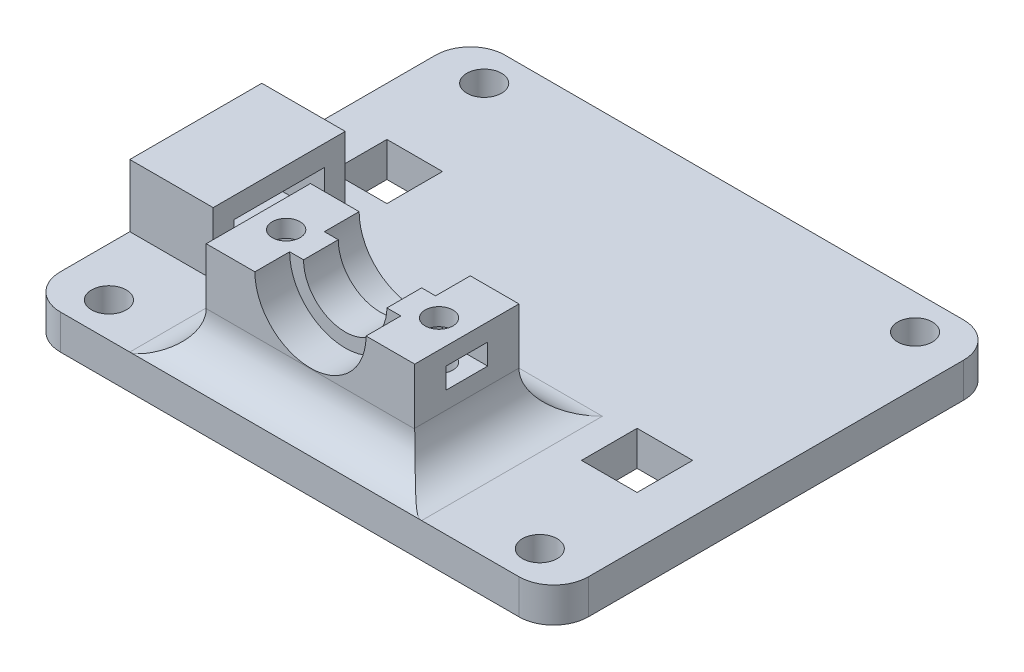
from build123d import *

# Parameters (mm, degrees)
SKETCH1_W           = 76
SKETCH1_H           = 64
SKETCH1_R           = 2.5
BOSS_EXTRUDE1_DEPTH = 5
SKETCH2_W           = 30
SKETCH2_H           = 15
BOSS_EXTRUDE2_DEPTH = 14
SKETCH3_R           = 6
CUT_EXTRUDE1_DEPTH  = 76.964442768
CUT_EXTRUDE2_DEPTH  = 5
CUT_EXTRUDE3_START  = -5
CUT_EXTRUDE3_DEPTH  = 5
FILLET1_R           = 6
SKETCH6_W           = 8
SKETCH6_H           = 8
CUT_EXTRUDE4_DEPTH  = 66.432910035
SKETCH7_W           = 12
SKETCH7_H           = 19
BOSS_EXTRUDE3_DEPTH = 9
SKETCH9_W           = 13
SKETCH9_H           = 6
CUT_EXTRUDE5_DEPTH  = 14
FILLET3_R           = 5
CUT_EXTRUDE6_DEPTH  = 9
SKETCH11_W          = 3
SKETCH11_H          = 1.5
CUT_EXTRUDE7_DEPTH  = 6.5
SKETCH13_W          = 3
SKETCH13_H          = 1.5
CUT_EXTRUDE8_DEPTH  = 6.5


with BuildPart() as part:
    # Sketch1 → Boss-Extrude1 (new body)
    with BuildSketch(Plane(origin=(0, 0, 0), x_dir=(1, 0, 0), z_dir=(0, 1, 0))):
        with Locations((5.915789474, -14.442105263)):
            Rectangle(SKETCH1_W, SKETCH1_H)
        with Locations(Location((36.915789474, 12.557894737, 0), (0, 0, 270))):
            Circle(SKETCH1_R, mode=Mode.SUBTRACT)
        with Locations(Location((-25.084210526, 12.557894737, 0), (0, 0, 270))):
            Circle(SKETCH1_R, mode=Mode.SUBTRACT)
        with Locations(Location((36.915789474, -41.442105263, 0), (0, 0, 270))):
            Circle(SKETCH1_R, mode=Mode.SUBTRACT)
        with Locations(Location((-25.084210526, -41.442105263, 0), (0, 0, 270))):
            Circle(SKETCH1_R, mode=Mode.SUBTRACT)
    extrude(amount=BOSS_EXTRUDE1_DEPTH)

    # Sketch2 → Boss-Extrude2 (add)
    with BuildSketch(Plane(origin=(0, 5, 0), x_dir=(1, 0, 0), z_dir=(0, 1, 0))):
        with Locations((3.915789474, -33.942105263)):
            Rectangle(SKETCH2_W, SKETCH2_H)
    extrude(amount=BOSS_EXTRUDE2_DEPTH)

    # Sketch3 → Cut-Extrude1 (cut, through all)
    with BuildSketch(Plane.XY.offset(41.442105263)):
        with Locations((3.915789474, 19)):
            Circle(SKETCH3_R)
    extrude(amount=-CUT_EXTRUDE1_DEPTH, mode=Mode.SUBTRACT)

    # Sketch4 → Cut-Extrude2 (cut)
    with BuildSketch(Plane.XY.offset(41.442105263)):
        with BuildLine():
            ThreePointArc((9.915789474, 19), (3.915789474, 13), (-2.084210526, 19))
            Line((-2.084210526, 19), (-4.084210526, 19))
            ThreePointArc((-4.084210526, 19), (3.915789474, 11), (11.915789474, 19))
            Line((11.915789474, 19), (9.915789474, 19))
        make_face()
    extrude(amount=-CUT_EXTRUDE2_DEPTH, mode=Mode.SUBTRACT)

    # Sketch5 → Cut-Extrude3 (cut)
    with BuildSketch(Plane(origin=(0, 0, 26.442105263), x_dir=(-1, 0, 0), z_dir=(0, 0, -1)).offset(CUT_EXTRUDE3_START)):
        with BuildLine():
            ThreePointArc((2.084210526, 19), (-3.915789474, 13), (-9.915789474, 19))
            Line((-9.915789474, 19), (-11.915789474, 19))
            ThreePointArc((-11.915789474, 19), (-3.915789474, 11), (4.084210526, 19))
            Line((4.084210526, 19), (2.084210526, 19))
        make_face()
    extrude(amount=CUT_EXTRUDE3_DEPTH, mode=Mode.SUBTRACT)

    # Fillet1
    # the kernel refuses this fillet: 6 mm, written as the material it adds along each edge
    with BuildSketch(Plane(origin=(-11.084210526, 5, 41.442105263), x_dir=(-1, 0, 0), z_dir=(0, 0, -1)), Plane(origin=(18.915789474, 5, 26.442105263), x_dir=(1, 0, 0), z_dir=(0, 0, 1))) as fillet1_piece_1:
        with BuildLine():
            CenterArc((FILLET1_R, FILLET1_R), FILLET1_R, 180, 90)
            Line((0, FILLET1_R), (-FILLET1_R * 0.02, FILLET1_R))
            Line((-FILLET1_R * 0.02, FILLET1_R), (-FILLET1_R * 0.02, -FILLET1_R * 0.02))
            Line((-FILLET1_R * 0.02, -FILLET1_R * 0.02), (FILLET1_R, -FILLET1_R * 0.02))
            Line((FILLET1_R, -FILLET1_R * 0.02), (FILLET1_R, 0))
        make_face()
    extrude(amount=15)
    with BuildSketch(Plane(origin=(18.915789474, 5, 41.442105263), x_dir=(0, 0, 1), z_dir=(-1, 0, 0))) as fillet1_piece_2:
        with BuildLine():
            CenterArc((6, 5.916079783), FILLET1_R, 180, 80.405931773)
            Line((0, 5.916079783), (-0.12, 5.916079783))
            Line((-0.12, 5.916079783), (-0.12, 0))
            Line((-0.12, 0), (0, -0.12))
            ThreePointArc((0, -0.12), (2.5, -0.12), (4.98, -0.118321596))
            Line((4.98, -0.118321596), (5, 0))
        make_face()
    extrude(amount=30)
    with BuildSketch(Plane(origin=(-11.084210526, 5, 26.442105263), x_dir=(0, 0, -1), z_dir=(1, 0, 0))) as fillet1_piece_3:
        with BuildLine():
            CenterArc((FILLET1_R, FILLET1_R), FILLET1_R, 180, 90)
            Line((0, FILLET1_R), (-FILLET1_R * 0.02, FILLET1_R))
            Line((-FILLET1_R * 0.02, FILLET1_R), (-FILLET1_R * 0.02, -FILLET1_R * 0.02))
            Line((-FILLET1_R * 0.02, -FILLET1_R * 0.02), (FILLET1_R, -FILLET1_R * 0.02))
            Line((FILLET1_R, -FILLET1_R * 0.02), (FILLET1_R, 0))
        make_face()
    extrude(amount=30)
    with BuildSketch(Plane(origin=(18.915789474, 5, 41.442105263), x_dir=(0, 0, 1), z_dir=(-1, 0, 0))) as fillet1_piece_4a_section:
        with BuildLine():
            CenterArc((6, 5.916079783), FILLET1_R, 180, 80.405931773)
            Line((0, 5.916079783), (-0.12, 5.916079783))
            Line((-0.12, 5.916079783), (-0.12, 0))
            Line((-0.12, 0), (0, -0.12))
            ThreePointArc((0, -0.12), (2.5, -0.12), (4.98, -0.118321596))
            Line((4.98, -0.118321596), (5, 0))
        make_face()
    fillet1_piece_4a = extrude(amount=44.790199458, mode=Mode.PRIVATE)
    fillet1_piece_4a = fillet1_piece_4a - Plane(origin=(-25.084210526, 6.312351874, 41.442105263), x_dir=(0, 0, 1), z_dir=(0, -1, 0)) * Cylinder(2.5, 114, mode=Mode.PRIVATE)
    fillet1_piece_4a = split(fillet1_piece_4a, bisect_by=Plane(origin=(-11.084210526, 6.312351874, 42.775348467), z_dir=(-1, 0, 0)), keep=Keep.TOP, mode=Mode.PRIVATE)
    with BuildSketch(Plane(origin=(-11.084210526, 5, 56.442105263), x_dir=(-1, 0, 0), z_dir=(0, 0, -1))) as fillet1_piece_4b_section:
        with BuildLine():
            CenterArc((FILLET1_R, FILLET1_R), FILLET1_R, 180, 90)
            Line((0, FILLET1_R), (-FILLET1_R * 0.02, FILLET1_R))
            Line((-FILLET1_R * 0.02, FILLET1_R), (-FILLET1_R * 0.02, -FILLET1_R * 0.02))
            Line((-FILLET1_R * 0.02, -FILLET1_R * 0.02), (FILLET1_R, -FILLET1_R * 0.02))
            Line((FILLET1_R, -FILLET1_R * 0.02), (FILLET1_R, 0))
        make_face()
    fillet1_piece_4b = extrude(amount=30, mode=Mode.PRIVATE)
    fillet1_piece_4b = split(fillet1_piece_4b, bisect_by=Plane(origin=(-12.442581212, 6.358370686, 46.442105263), z_dir=(0, 0, -1)), keep=Keep.TOP, mode=Mode.PRIVATE)
    fillet1_piece_4b = split(fillet1_piece_4b, bisect_by=Plane(origin=(-12.442581212, 6.358370686, 41.442105263), z_dir=(0, 0, 1)), keep=Keep.TOP, mode=Mode.PRIVATE)
    fillet1_piece_4 = fillet1_piece_4a & fillet1_piece_4b
    add(fillet1_piece_4)
    with BuildSketch(Plane(origin=(-26.084210526, 5, 26.442105263), x_dir=(0, 0, -1), z_dir=(1, 0, 0))) as fillet1_piece_5a_section:
        with BuildLine():
            CenterArc((FILLET1_R, FILLET1_R), FILLET1_R, 180, 90)
            Line((0, FILLET1_R), (-FILLET1_R * 0.02, FILLET1_R))
            Line((-FILLET1_R * 0.02, FILLET1_R), (-FILLET1_R * 0.02, -FILLET1_R * 0.02))
            Line((-FILLET1_R * 0.02, -FILLET1_R * 0.02), (FILLET1_R, -FILLET1_R * 0.02))
            Line((FILLET1_R, -FILLET1_R * 0.02), (FILLET1_R, 0))
        make_face()
    fillet1_piece_5a = extrude(amount=45, mode=Mode.PRIVATE)
    fillet1_piece_5a = split(fillet1_piece_5a, bisect_by=Plane(origin=(-11.084210526, 6.358370686, 25.083734578), z_dir=(-1, 0, 0)), keep=Keep.TOP, mode=Mode.PRIVATE)
    with BuildSketch(Plane(origin=(-11.084210526, 5, 41.442105263), x_dir=(-1, 0, 0), z_dir=(0, 0, -1))) as fillet1_piece_5b_section:
        with BuildLine():
            CenterArc((FILLET1_R, FILLET1_R), FILLET1_R, 180, 90)
            Line((0, FILLET1_R), (-FILLET1_R * 0.02, FILLET1_R))
            Line((-FILLET1_R * 0.02, FILLET1_R), (-FILLET1_R * 0.02, -FILLET1_R * 0.02))
            Line((-FILLET1_R * 0.02, -FILLET1_R * 0.02), (FILLET1_R, -FILLET1_R * 0.02))
            Line((FILLET1_R, -FILLET1_R * 0.02), (FILLET1_R, 0))
        make_face()
    fillet1_piece_5b = extrude(amount=30, mode=Mode.PRIVATE)
    fillet1_piece_5b = split(fillet1_piece_5b, bisect_by=Plane(origin=(-12.442581212, 6.358370686, 26.442105263), z_dir=(0, 0, -1)), keep=Keep.TOP, mode=Mode.PRIVATE)
    fillet1_piece_5 = fillet1_piece_5a & fillet1_piece_5b
    add(fillet1_piece_5)
    with BuildSketch(Plane(origin=(18.915789474, 5, 26.442105263), x_dir=(1, 0, 0), z_dir=(0, 0, 1))) as fillet1_piece_6a_section:
        with BuildLine():
            CenterArc((FILLET1_R, FILLET1_R), FILLET1_R, 180, 90)
            Line((0, FILLET1_R), (-FILLET1_R * 0.02, FILLET1_R))
            Line((-FILLET1_R * 0.02, FILLET1_R), (-FILLET1_R * 0.02, -FILLET1_R * 0.02))
            Line((-FILLET1_R * 0.02, -FILLET1_R * 0.02), (FILLET1_R, -FILLET1_R * 0.02))
            Line((FILLET1_R, -FILLET1_R * 0.02), (FILLET1_R, 0))
        make_face()
    fillet1_piece_6a = extrude(amount=30, mode=Mode.PRIVATE)
    fillet1_piece_6a = split(fillet1_piece_6a, bisect_by=Plane(origin=(20.274160159, 6.358370686, 46.442105263), z_dir=(0, 0, -1)), keep=Keep.TOP, mode=Mode.PRIVATE)
    fillet1_piece_6a = split(fillet1_piece_6a, bisect_by=Plane(origin=(20.274160159, 6.358370686, 41.442105263), z_dir=(0, 0, 1)), keep=Keep.TOP, mode=Mode.PRIVATE)
    with BuildSketch(Plane(origin=(33.705988931, 5, 41.442105263), x_dir=(0, 0, 1), z_dir=(-1, 0, 0))) as fillet1_piece_6b_section:
        with BuildLine():
            CenterArc((6, 5.916079783), FILLET1_R, 180, 80.405931773)
            Line((0, 5.916079783), (-0.12, 5.916079783))
            Line((-0.12, 5.916079783), (-0.12, 0))
            Line((-0.12, 0), (0, -0.12))
            ThreePointArc((0, -0.12), (2.5, -0.12), (4.98, -0.118321596))
            Line((4.98, -0.118321596), (5, 0))
        make_face()
    fillet1_piece_6b = extrude(amount=44.790199458, mode=Mode.PRIVATE)
    fillet1_piece_6b = split(fillet1_piece_6b, bisect_by=Plane(origin=(18.915789474, 6.37196406, 42.676023134), z_dir=(1, 0, 0)), keep=Keep.TOP, mode=Mode.PRIVATE)
    fillet1_piece_6 = fillet1_piece_6a & fillet1_piece_6b
    add(fillet1_piece_6)
    with BuildSketch(Plane(origin=(-11.084210526, 5, 26.442105263), x_dir=(0, 0, -1), z_dir=(1, 0, 0))) as fillet1_piece_7a_section:
        with BuildLine():
            CenterArc((FILLET1_R, FILLET1_R), FILLET1_R, 180, 90)
            Line((0, FILLET1_R), (-FILLET1_R * 0.02, FILLET1_R))
            Line((-FILLET1_R * 0.02, FILLET1_R), (-FILLET1_R * 0.02, -FILLET1_R * 0.02))
            Line((-FILLET1_R * 0.02, -FILLET1_R * 0.02), (FILLET1_R, -FILLET1_R * 0.02))
            Line((FILLET1_R, -FILLET1_R * 0.02), (FILLET1_R, 0))
        make_face()
    fillet1_piece_7a = extrude(amount=45, mode=Mode.PRIVATE)
    fillet1_piece_7a = split(fillet1_piece_7a, bisect_by=Plane(origin=(18.915789474, 6.358370686, 25.083734578), z_dir=(1, 0, 0)), keep=Keep.TOP, mode=Mode.PRIVATE)
    with BuildSketch(Plane(origin=(18.915789474, 5, 11.442105263), x_dir=(1, 0, 0), z_dir=(0, 0, 1))) as fillet1_piece_7b_section:
        with BuildLine():
            CenterArc((FILLET1_R, FILLET1_R), FILLET1_R, 180, 90)
            Line((0, FILLET1_R), (-FILLET1_R * 0.02, FILLET1_R))
            Line((-FILLET1_R * 0.02, FILLET1_R), (-FILLET1_R * 0.02, -FILLET1_R * 0.02))
            Line((-FILLET1_R * 0.02, -FILLET1_R * 0.02), (FILLET1_R, -FILLET1_R * 0.02))
            Line((FILLET1_R, -FILLET1_R * 0.02), (FILLET1_R, 0))
        make_face()
    fillet1_piece_7b = extrude(amount=30, mode=Mode.PRIVATE)
    fillet1_piece_7b = split(fillet1_piece_7b, bisect_by=Plane(origin=(20.274160159, 6.358370686, 26.442105263), z_dir=(0, 0, -1)), keep=Keep.TOP, mode=Mode.PRIVATE)
    fillet1_piece_7 = fillet1_piece_7a & fillet1_piece_7b
    add(fillet1_piece_7)

    # Sketch6 → Cut-Extrude4 (cut, through all)
    with BuildSketch(Plane(origin=(0, 5, 0), x_dir=(1, 0, 0), z_dir=(0, 1, 0))):
        with Locations((32.915789474, -23.442105263)):
            Rectangle(SKETCH6_W, SKETCH6_H)
        with Locations((-21.084210526, -5.442105263)):
            Rectangle(SKETCH6_W, SKETCH6_H)
    extrude(amount=-CUT_EXTRUDE4_DEPTH, mode=Mode.SUBTRACT)

    # Sketch7 → Boss-Extrude3 (add)
    with BuildSketch(Plane(origin=(0, 5, 0), x_dir=(1, 0, 0), z_dir=(0, 1, 0))):
        with Locations((-26.084210526, -21.942105263)):
            Rectangle(SKETCH7_W, SKETCH7_H)
    extrude(amount=BOSS_EXTRUDE3_DEPTH)

    # Sketch9 → Cut-Extrude5 (cut)
    with BuildSketch(Plane.ZY.offset(32.084210526)):
        with Locations((21.942105263, 8)):
            Rectangle(SKETCH9_W, SKETCH9_H)
    extrude(amount=-CUT_EXTRUDE5_DEPTH, mode=Mode.SUBTRACT)

    # Fillet3
    fillet3_edges = [part.edges().sort_by_distance(p)[0] for p in [
        (-32.084210526, 2.5, -17.557894737),
        (43.915789474, 2.5, -17.557894737),
        (43.915789474, 2.5, 46.442105263),
        (-32.084210526, 2.5, 46.442105263),
    ]]
    fillet(fillet3_edges, radius=FILLET3_R)

    # Sketch10 → Cut-Extrude6 (cut)
    with BuildSketch(Plane(origin=(0, 19, 0), x_dir=(1, 0, 0), z_dir=(0, 1, 0))):
        with BuildLine():
            ThreePointArc((-5.084210526, -33.942105263), (-7.084210526, -31.942105263), (-9.084210526, -33.942105263))
            Line((-9.084210526, -33.942105263), (-5.084210526, -33.942105263))
        make_face()
        with BuildLine():
            Line((-5.084210526, -33.942105263), (-9.084210526, -33.942105263))
            ThreePointArc((-9.084210526, -33.942105263), (-7.084210526, -35.942105263), (-5.084210526, -33.942105263))
        make_face()
        with BuildLine():
            ThreePointArc((16.915789474, -33.942105263), (14.915789474, -31.942105263), (12.915789474, -33.942105263))
            Line((12.915789474, -33.942105263), (16.915789474, -33.942105263))
        make_face()
        with BuildLine():
            Line((16.915789474, -33.942105263), (12.915789474, -33.942105263))
            ThreePointArc((12.915789474, -33.942105263), (14.915789474, -35.942105263), (16.915789474, -33.942105263))
        make_face()
    extrude(amount=-CUT_EXTRUDE6_DEPTH, mode=Mode.SUBTRACT)

    # Sketch11 → Cut-Extrude7 (cut)
    with BuildSketch(Plane.ZY.offset(11.084210526)):
        with Locations((32.442105263, 15.75)):
            Rectangle(SKETCH11_W, SKETCH11_H)
        with Locations((35.442105263, 15.75)):
            Rectangle(SKETCH11_W, SKETCH11_H)
        with Locations((35.442105263, 14.25)):
            Rectangle(SKETCH11_W, SKETCH11_H)
        with Locations((32.442105263, 14.25)):
            Rectangle(SKETCH11_W, SKETCH11_H)
    extrude(amount=-CUT_EXTRUDE7_DEPTH, mode=Mode.SUBTRACT)

    # Sketch13 → Cut-Extrude8 (cut)
    with BuildSketch(Plane(origin=(18.915789474, 0, 0), x_dir=(0, 0, -1), z_dir=(1, 0, 0))):
        with Locations((-35.442105263, 15.75)):
            Rectangle(SKETCH13_W, SKETCH13_H)
        with Locations((-32.442105263, 15.75)):
            Rectangle(SKETCH13_W, SKETCH13_H)
        with Locations((-32.442105263, 14.25)):
            Rectangle(SKETCH13_W, SKETCH13_H)
        with Locations((-35.442105263, 14.25)):
            Rectangle(SKETCH13_W, SKETCH13_H)
    extrude(amount=-CUT_EXTRUDE8_DEPTH, mode=Mode.SUBTRACT)


solid = part.part
